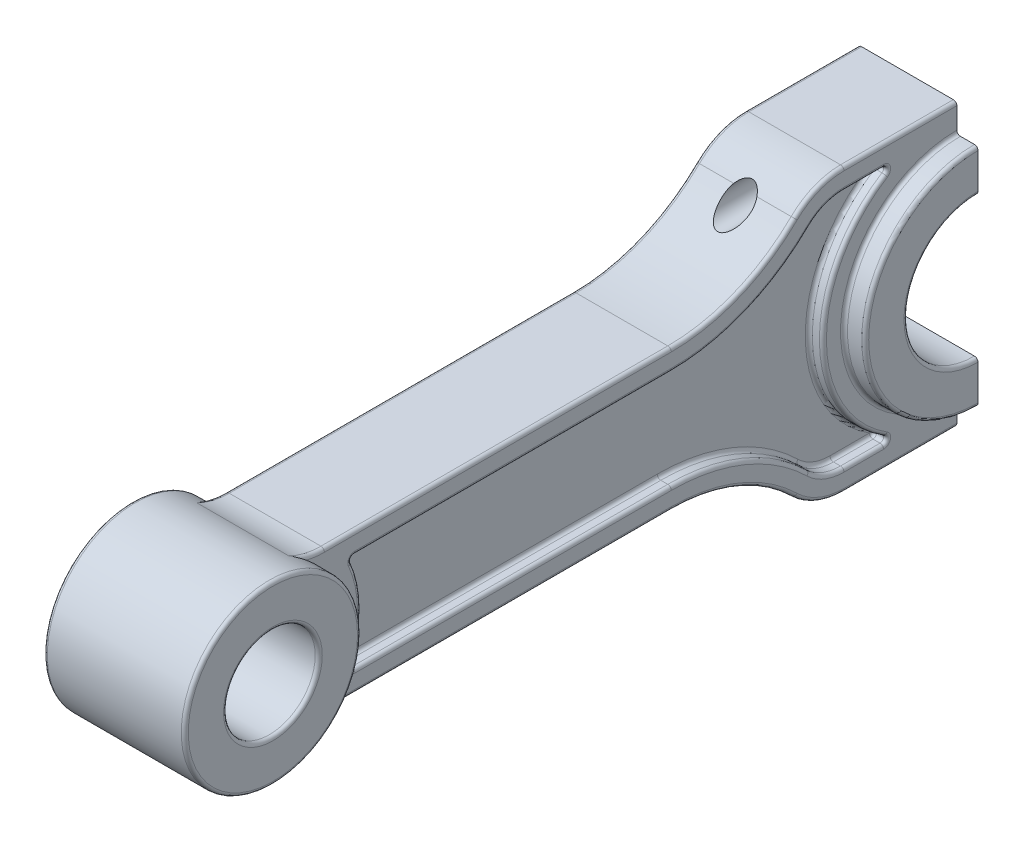
from build123d import *

# Parameters (mm, degrees)
BOSS_EXTRUDE1_DEPTH = 10
BOSS_EXTRUDE2_DEPTH = 7
SKETCH1_4_R         = 12.499999999999998
SKETCH1_4_R_2       = 6.500000000000004
BOSS_EXTRUDE3_DEPTH = 10
SKETCH1_6_R         = 12.499999999999998
SKETCH1_6_R_2       = 6.500000000000004
BOSS_EXTRUDE4_DEPTH = 5
FILLET1_R           = 0.5
FILLET2_R           = 0.5
SKETCH4_R           = 2.000000000000001
SKETCH4_R_2         = 2.0000000000000004
CUT_EXTRUDE1_DEPTH  = 36.00000000000001
FILLET3_R           = 0.5


with BuildPart() as part:
    # Sketch1 → Boss-Extrude1 (new, symmetric)
    with BuildSketch(Plane.YZ):
        with BuildLine():
            ThreePointArc((16, 0), (-1.24e-15, 16.000000000000004), (-16, -7.1e-16))
            Line((-16, 0), (-10, 0))
            ThreePointArc((-10, 1.22e-15), (-2.8e-16, 10), (10, 0))
            Line((10, 0), (16, 2.94e-15))
        make_face()
    extrude(amount=BOSS_EXTRUDE1_DEPTH, both=True)

    # Sketch1<3> → Boss-Extrude2 (add, symmetric)
    with BuildSketch(Plane.YZ):
        with BuildLine():
            ThreePointArc((-17.14285714285714, 22.998542122237655), (-19.258200997725517, 19.779644730092276), (-20, 16))
            Line((-20, 16), (-19.999999999999996, 0))
            Line((-19.999999999999996, 0), (-16, 0))
            ThreePointArc((-16, -7.1e-16), (-1.24e-15, 16.000000000000004), (16, 0))
            Line((16, 2.94e-15), (20.000000000000025, 4.9e-15))
            Line((20.000000000000025, 5.33e-15), (20.00000000000002, 16.000000000000004))
            ThreePointArc((20.00000000000002, 16.000000000000004), (19.258200997725535, 19.77964473009228), (17.14285714285716, 22.99854212223766))
            ThreePointArc((17.142857142857164, 22.998542122237662), (11.854497505686236, 31.045785602601107), (10.000000000000014, 40.49489742783179))
            Line((10.000000000000007, 40.49489742783179), (9.999999999999993, 89.69223593595584))
            ThreePointArc((9.999999999999993, 89.69223593595584), (10.281746841924491, 92.049258539911), (11.111111111111105, 94.27346440886436))
            ThreePointArc((11.111111111111107, 94.27346440886436), (0, 87.5), (-11.111111111111107, 94.27346440886436))
            ThreePointArc((-11.111111111111105, 94.27346440886436), (-10.281746841924491, 92.049258539911), (-9.999999999999993, 89.69223593595584))
            Line((-9.999999999999993, 89.69223593595584), (-9.999999999999991, 40.49489742783179))
            ThreePointArc((-9.999999999999993, 40.49489742783179), (-11.854497505686211, 31.045785602601107), (-17.14285714285714, 22.998542122237655))
        make_face()
        with BuildLine():
            Line((-16.999999999999996, 10.392304845413271), (-17, 16))
            ThreePointArc((-17, 16), (-16.480740698407857, 18.645751311064593), (-14.999999999999996, 20.89897948556636))
            ThreePointArc((-15, 20.898979485566365), (-9.077037206368551, 29.91189218357342), (-7, 40.49489742783178))
            Line((-6.999999999999999, 40.49489742783178), (-6.999999999999993, 85.37980848278654))
            ThreePointArc((-6.999999999999999, 85.37980848278654), (-6.772431183971286, 85.79907122856775), (-6.296874999999996, 85.83668946769947))
            ThreePointArc((-6.296874999999995, 85.83668946769947), (-2.66e-15, 84.5), (6.29687499999999, 85.83668946769947))
            ThreePointArc((6.296874999999996, 85.83668946769947), (6.772431183971286, 85.79907122856775), (7, 85.37980848278654))
            Line((6.999999999999993, 85.37980848278654), (7.000000000000006, 40.49489742783179))
            ThreePointArc((7.000000000000007, 40.494897427831795), (9.077037206368566, 29.911892183573425), (15.000000000000014, 20.89897948556636))
            ThreePointArc((15.000000000000018, 20.89897948556636), (16.48074069840788, 18.645751311064597), (17.00000000000002, 16.000000000000004))
            Line((17.00000000000002, 16.000000000000004), (17.000000000000018, 10.392304845413268))
            ThreePointArc((17.000000000000018, 10.392304845413268), (16.638675049056324, 9.911920383998007), (16.076923076923094, 10.12583549040267))
            ThreePointArc((16.076923076923094, 10.12583549040267), (1.155e-14, 19.000000000000018), (-16.076923076923077, 10.125835490402675))
            ThreePointArc((-16.07692307692308, 10.125835490402677), (-16.638675049056307, 9.911920383998012), (-17, 10.392304845413271))
        make_face(mode=Mode.SUBTRACT)
    extrude(amount=BOSS_EXTRUDE2_DEPTH, both=True)

    # Sketch1<4> → Boss-Extrude3 (add, symmetric)
    with BuildSketch(Plane.YZ):
        with Locations(Location((0, 100, 0), (0, 0, 270))):
            Circle(SKETCH1_4_R)
        with Locations(Location((0, 100, 0), (0, 0, 270))):
            Circle(SKETCH1_4_R_2, mode=Mode.SUBTRACT)
    extrude(amount=BOSS_EXTRUDE3_DEPTH, both=True)

    # Sketch1<6> → Boss-Extrude4 (add, symmetric)
    # profile 1 of 2: a face of its own
    with BuildSketch(Plane.YZ):
        with Locations(Location((0, 100, 0), (0, 0, 270))):
            Circle(SKETCH1_6_R)
        with Locations(Location((0, 100, 0), (0, 0, 270))):
            Circle(SKETCH1_6_R_2, mode=Mode.SUBTRACT)
    # profile 2 of 2: a face of its own
    with BuildSketch(Plane.YZ):
        with BuildLine():
            Line((-17, 16), (-16.999999999999996, 10.392304845413271))
            ThreePointArc((-16.999999999999996, 10.392304845413271), (-16.638675049056303, 9.911920383998012), (-16.076923076923077, 10.125835490402675))
            ThreePointArc((-16.076923076923077, 10.125835490402675), (5.38e-15, 19.000000000000018), (16.076923076923094, 10.12583549040267))
            ThreePointArc((16.076923076923094, 10.12583549040267), (16.638675049056324, 9.911920383998007), (17.000000000000018, 10.392304845413268))
            Line((17.000000000000018, 10.392304845413268), (17.00000000000002, 16.000000000000004))
            ThreePointArc((17.00000000000002, 16.000000000000004), (16.48074069840788, 18.645751311064597), (15.000000000000018, 20.89897948556636))
            ThreePointArc((15.000000000000018, 20.89897948556636), (9.07703720636857, 29.91189218357342), (7.000000000000006, 40.49489742783179))
            Line((7.000000000000006, 40.49489742783179), (6.999999999999993, 85.37980848278654))
            ThreePointArc((6.999999999999993, 85.37980848278654), (6.772431183971287, 85.79907122856775), (6.296874999999994, 85.83668946769947))
            ThreePointArc((6.296874999999994, 85.83668946769947), (9.5e-16, 84.5), (-6.296874999999994, 85.83668946769947))
            ThreePointArc((-6.296874999999994, 85.83668946769947), (-6.772431183971286, 85.79907122856775), (-6.999999999999993, 85.37980848278654))
            Line((-6.999999999999993, 85.37980848278654), (-6.999999999999999, 40.49489742783178))
            ThreePointArc((-6.999999999999999, 40.49489742783178), (-9.077037206368551, 29.91189218357342), (-14.999999999999996, 20.89897948556636))
            ThreePointArc((-14.999999999999996, 20.89897948556636), (-16.480740698407857, 18.645751311064593), (-17, 16))
        make_face()
    extrude(amount=BOSS_EXTRUDE4_DEPTH, both=True)

    # Fillet1
    fillet1_edges = [part.edges().sort_by_distance(p)[0] for p in [
        (10, 9.8e-16, 16.000000000000004),
        (5, -16.638675049056307, 9.911920383998012),
        (5, 1.155e-14, 19.000000000000018),
        (5, 16.638675049056324, 9.911920383998007),
        (5, 17.00000000000002, 13.196152422706636),
        (-5, 16.48074069840788, 18.645751311064597),
        (-5, 9.077037206368566, 29.911892183573425),
        (-5, 7, 62.937352955309166),
        (-5, 6.772431183971286, 85.79907122856775),
        (5, 2.66e-15, 84.5),
        (5, -6.772431183971286, 85.79907122856775),
        (5, -6.9999999999999964, 62.937352955309166),
        (5, -9.077037206368551, 29.91189218357342),
        (5, -16.480740698407857, 18.645751311064593),
        (-5, -17, 13.196152422706636),
        (5, 16.48074069840788, 18.645751311064597),
        (5, 9.077037206368566, 29.911892183573425),
        (5, 7, 62.937352955309166),
        (5, 6.772431183971286, 85.79907122856775),
        (5, -17, 13.196152422706636),
        (-5, -16.638675049056307, 9.911920383998012),
        (-5, -16.480740698407857, 18.645751311064593),
        (-5, -9.077037206368551, 29.91189218357342),
        (-5, -6.9999999999999964, 62.937352955309166),
        (-5, -6.772431183971286, 85.79907122856775),
        (-5, 2.66e-15, 84.5),
        (-5, 17.00000000000002, 13.196152422706636),
        (-5, 16.638675049056324, 9.911920383998007),
        (-5, 1.155e-14, 19.000000000000018),
        (-7, 9.77e-15, 19.000000000000014),
        (-7, -16.638675049056307, 9.911920383998012),
        (7, -17, 13.196152422706636),
        (-7, -16.480740698407857, 18.645751311064593),
        (-7, -9.077037206368551, 29.91189218357342),
        (-7, -6.9999999999999964, 62.937352955309166),
        (-7, -6.772431183971288, 85.79907122856775),
        (-7, -4e-15, 84.5),
        (7, 6.772431183971288, 85.79907122856775),
        (7, 7, 62.937352955309166),
        (7, 9.07703720636857, 29.91189218357343),
        (7, 16.48074069840788, 18.645751311064597),
        (-7, 17.00000000000002, 13.196152422706636),
        (7, -2.57e-15, 16.000000000000004),
        (-7, 16.638675049056324, 9.911920383998007),
        (7, 9.77e-15, 19.000000000000014),
        (7, -16.638675049056307, 9.911920383998012),
        (7, -16.480740698407857, 18.645751311064593),
        (7, -9.077037206368551, 29.91189218357342),
        (7, -6.9999999999999964, 62.937352955309166),
        (7, -6.772431183971288, 85.79907122856775),
        (7, -4e-15, 84.5),
        (7, 17.00000000000002, 13.196152422706636),
        (7, 16.638675049056324, 9.911920383998007),
        (-7, -2.57e-15, 16.000000000000004),
        (-7, 16.48074069840788, 18.645751311064597),
        (-7, 9.07703720636857, 29.91189218357343),
        (-7, 7, 62.937352955309166),
        (-7, 6.772431183971288, 85.79907122856775),
        (-7, -17, 13.196152422706636),
        (-10, 9.8e-16, 16.000000000000004),
    ]]
    fillet(fillet1_edges, radius=FILLET1_R)

    # Fillet2
    # the kernel refuses this fillet: 0.5 mm, written as the material it takes off along each edge
    with BuildSketch(Plane(origin=(-7, 10.000000000000039, 16.000000000000014), x_dir=(0, 1, -1.07e-15), z_dir=(0, -1.07e-15, -1))) as fillet2_piece_1:
        with BuildLine():
            CenterArc((9.999999999999982 - FILLET2_R, FILLET2_R), FILLET2_R, 270, 90)
            Line((9.999999999999982, FILLET2_R), (9.999999999999982, 0))
            Line((9.999999999999982, 0), (9.999999999999982 - FILLET2_R, 0))
        make_face()
    revolve(axis=Axis((-7, 10.000000000000039, 16.000000000000014), (1, 0, 0)), revolution_arc=44.4153085971931, mode=Mode.SUBTRACT)
    with BuildSketch(Plane(origin=(-7, 35.000000000000085, 40.49489742783182), x_dir=(0, -0.714285714285715, -0.6998542122237645), z_dir=(0, 0.6998542122237645, -0.714285714285715))) as fillet2_piece_2:
        with BuildLine():
            CenterArc((25.000000000000075 + FILLET2_R, -FILLET2_R), FILLET2_R, 90, 90)
            Line((25.000000000000075, -FILLET2_R), (25.000000000000075, 0))
            Line((25.000000000000075, 0), (25.000000000000075 + FILLET2_R, 0))
        make_face()
    revolve(axis=Axis((-7, 35.000000000000085, 40.49489742783182), (-1, 0, 0)), revolution_arc=44.41530859719284, mode=Mode.SUBTRACT)
    with BuildSketch(Plane(origin=(-7, 10.000000000000007, 40.49489742783179), x_dir=(0, -1, -2.9e-16), z_dir=(0, -2.9e-16, 1)), Plane(origin=(-7, -9.999999999999993, 89.69223593595584), x_dir=(0, 1, 4e-17), z_dir=(0, 4e-17, -1))) as fillet2_piece_3:
        with BuildLine():
            CenterArc((FILLET2_R, FILLET2_R), FILLET2_R, 180, 90)
            Line((0, FILLET2_R), (0, 0))
            Line((0, 0), (FILLET2_R, 0))
        make_face()
    extrude(amount=49.19733850812405, mode=Mode.SUBTRACT)
    with BuildSketch(Plane(origin=(7, 20.000000000000007, 89.69223593595584), x_dir=(0, -1, 0), z_dir=(0, 0, -1))) as fillet2_piece_4_section:
        with BuildLine():
            CenterArc((10.000000000000014 + FILLET2_R, FILLET2_R), FILLET2_R, 180, 90)
            Line((10.000000000000014, FILLET2_R), (10.000000000000014, 0))
            Line((10.000000000000014, 0), (10.000000000000014 + FILLET2_R, 0))
        make_face()
    fillet2_piece_4 = revolve(axis=Axis((7, 20.000000000000007, 89.69223593595584), (-1, 0, 0)), revolution_arc=34.42828088240895, mode=Mode.PRIVATE)
    fillet2_piece_4 = fillet2_piece_4 - Plane(origin=(6.916500535686011, 0, 100), x_dir=(0, -1.8e-16, -1), z_dir=(1, 0, 0)) * Cylinder(12.499999999999998, 43, mode=Mode.PRIVATE)
    add(fillet2_piece_4, mode=Mode.SUBTRACT)
    with BuildSketch(Plane(origin=(-7, -19.999999999999968, 89.69223593595585), x_dir=(0, 0.8248345331629863, 0.5653742060810686), z_dir=(0, -0.5653742060810686, 0.8248345331629863))) as fillet2_piece_5_section:
        with BuildLine():
            CenterArc((9.999999999999979 + FILLET2_R, -FILLET2_R), FILLET2_R, 90, 90)
            Line((9.999999999999973, -FILLET2_R), (9.999999999999979, 0))
            Line((9.999999999999979, 0), (9.999999999999979 + FILLET2_R, 0))
        make_face()
    fillet2_piece_5 = revolve(axis=Axis((-7, -19.999999999999968, 89.69223593595585), (-1, 0, 0)), revolution_arc=34.4282808824091, mode=Mode.PRIVATE)
    fillet2_piece_5 = fillet2_piece_5 - Plane(origin=(-6.861994931360741, 0, 100), x_dir=(0, -1.8e-16, -1), z_dir=(1, 0, 0)) * Cylinder(12.499999999999998, 42, mode=Mode.PRIVATE)
    add(fillet2_piece_5, mode=Mode.SUBTRACT)
    with BuildSketch(Plane(origin=(7, -9.999999999999993, 89.69223593595584), x_dir=(0, 1, 4e-17), z_dir=(0, 4e-17, -1)), Plane(origin=(7, 10.000000000000007, 40.49489742783179), x_dir=(0, -1, -2.9e-16), z_dir=(0, -2.9e-16, 1))) as fillet2_piece_6:
        with BuildLine():
            CenterArc((FILLET2_R, -FILLET2_R), FILLET2_R, 90, 90)
            Line((0, -FILLET2_R), (0, 0))
            Line((0, 0), (FILLET2_R, 0))
        make_face()
    extrude(amount=49.19733850812405, mode=Mode.SUBTRACT)
    with BuildSketch(Plane(origin=(7, -35.000000000000014, 40.494897427831795), x_dir=(0, 1, -2.8e-16), z_dir=(0, 2.8e-16, 1))) as fillet2_piece_7:
        with BuildLine():
            CenterArc((25.000000000000018 + FILLET2_R, FILLET2_R), FILLET2_R, 180, 90)
            Line((25.000000000000018, FILLET2_R), (25.000000000000018, 0))
            Line((25.000000000000018, 0), (25.000000000000018 + FILLET2_R, 0))
        make_face()
    revolve(axis=Axis((7, -35.000000000000014, 40.494897427831795), (-1, 0, 0)), revolution_arc=44.41530859719295, mode=Mode.SUBTRACT)
    with BuildSketch(Plane(origin=(7, -10.000000000000043, 16.000000000000014), x_dir=(0, -0.7142857142857125, 0.699854212223767), z_dir=(0, 0.699854212223767, 0.7142857142857125))) as fillet2_piece_8:
        with BuildLine():
            CenterArc((9.99999999999996 - FILLET2_R, -FILLET2_R), FILLET2_R, 0, 90)
            Line((9.99999999999996, -FILLET2_R), (9.99999999999996, 0))
            Line((9.99999999999996, 0), (9.99999999999996 - FILLET2_R, 0))
        make_face()
    revolve(axis=Axis((7, -10.000000000000043, 16.000000000000014), (1, 0, 0)), revolution_arc=44.4153085971932, mode=Mode.SUBTRACT)
    with BuildSketch(Plane(origin=(-7, -20, 16), x_dir=(0, 1, 2.2e-16), z_dir=(0, 2.2e-16, -1)), Plane(origin=(-7, 20.000000000000025, -1.249999999999993), x_dir=(0, -1, -2.2e-16), z_dir=(0, -2.2e-16, 1))) as fillet2_piece_9:
        with BuildLine():
            CenterArc((FILLET2_R, FILLET2_R), FILLET2_R, 180, 90)
            Line((0, FILLET2_R), (0, 0))
            Line((0, 0), (FILLET2_R, 0))
        make_face()
    extrude(amount=17.25, mode=Mode.SUBTRACT)
    with BuildSketch(Plane(origin=(7, 20.000000000000025, -1.2499999999999947), x_dir=(-1, 0, 0), z_dir=(0, -2.2e-16, 1))) as fillet2_piece_10:
        with BuildLine():
            CenterArc((FILLET2_R, FILLET2_R), FILLET2_R, 180, 90)
            Line((0, FILLET2_R), (0, 0))
            Line((0, 0), (FILLET2_R, 0))
        make_face()
    extrude(amount=17.25, mode=Mode.SUBTRACT)
    with BuildSketch(Plane(origin=(7, 10.000000000000039, 16.000000000000014), x_dir=(0, 1, -1.07e-15), z_dir=(0, -1.07e-15, -1))) as fillet2_piece_11:
        with BuildLine():
            CenterArc((9.999999999999982 - FILLET2_R, -FILLET2_R), FILLET2_R, 0, 90)
            Line((9.999999999999982, -FILLET2_R), (9.999999999999982, 0))
            Line((9.999999999999982, 0), (9.999999999999982 - FILLET2_R, 0))
        make_face()
    revolve(axis=Axis((7, 10.000000000000039, 16.000000000000014), (1, 0, 0)), revolution_arc=44.4153085971931, mode=Mode.SUBTRACT)
    with BuildSketch(Plane(origin=(7, 35.000000000000085, 40.49489742783182), x_dir=(0, -0.714285714285715, -0.6998542122237645), z_dir=(0, 0.6998542122237645, -0.714285714285715))) as fillet2_piece_12:
        with BuildLine():
            CenterArc((25.000000000000075 + FILLET2_R, FILLET2_R), FILLET2_R, 180, 90)
            Line((25.000000000000075, FILLET2_R), (25.000000000000075, 0))
            Line((25.000000000000075, 0), (25.000000000000075 + FILLET2_R, 0))
        make_face()
    revolve(axis=Axis((7, 35.000000000000085, 40.49489742783182), (-1, 0, 0)), revolution_arc=44.41530859719284, mode=Mode.SUBTRACT)
    with BuildSketch(Plane(origin=(7, -19.999999999999968, 89.69223593595585), x_dir=(0, 0.8248345331629863, 0.5653742060810686), z_dir=(0, -0.5653742060810686, 0.8248345331629863))) as fillet2_piece_13_section:
        with BuildLine():
            CenterArc((9.999999999999979 + FILLET2_R, FILLET2_R), FILLET2_R, 180, 90)
            Line((9.999999999999973, FILLET2_R), (9.999999999999979, 0))
            Line((9.999999999999979, 0), (9.999999999999979 + FILLET2_R, 0))
        make_face()
    fillet2_piece_13 = revolve(axis=Axis((7, -19.999999999999968, 89.69223593595585), (-1, 0, 0)), revolution_arc=34.4282808824091, mode=Mode.PRIVATE)
    fillet2_piece_13 = fillet2_piece_13 - Plane(origin=(6.861994931360841, 0, 100), x_dir=(0, -1.8e-16, -1), z_dir=(1, 0, 0)) * Cylinder(12.499999999999998, 42, mode=Mode.PRIVATE)
    add(fillet2_piece_13, mode=Mode.SUBTRACT)
    with BuildSketch(Plane(origin=(7, -20, 16), x_dir=(0, 1, 2.2e-16), z_dir=(0, 2.2e-16, -1))) as fillet2_piece_14:
        with BuildLine():
            CenterArc((FILLET2_R, -FILLET2_R), FILLET2_R, 90, 90)
            Line((0, -FILLET2_R), (0, 0))
            Line((0, 0), (FILLET2_R, 0))
        make_face()
    extrude(amount=17.25, mode=Mode.SUBTRACT)
    with BuildSketch(Plane(origin=(-7, -10.000000000000043, 16.000000000000014), x_dir=(0, -0.7142857142857125, 0.699854212223767), z_dir=(0, 0.699854212223767, 0.7142857142857125))) as fillet2_piece_15:
        with BuildLine():
            CenterArc((9.99999999999996 - FILLET2_R, FILLET2_R), FILLET2_R, 270, 90)
            Line((9.99999999999996, FILLET2_R), (9.99999999999996, 0))
            Line((9.99999999999996, 0), (9.99999999999996 - FILLET2_R, 0))
        make_face()
    revolve(axis=Axis((-7, -10.000000000000043, 16.000000000000014), (1, 0, 0)), revolution_arc=44.4153085971932, mode=Mode.SUBTRACT)
    with BuildSketch(Plane(origin=(-7, -35.000000000000014, 40.494897427831795), x_dir=(0, 1, -2.8e-16), z_dir=(0, 2.8e-16, 1))) as fillet2_piece_16:
        with BuildLine():
            CenterArc((25.000000000000018 + FILLET2_R, -FILLET2_R), FILLET2_R, 90, 90)
            Line((25.000000000000018, -FILLET2_R), (25.000000000000018, 0))
            Line((25.000000000000018, 0), (25.000000000000018 + FILLET2_R, 0))
        make_face()
    revolve(axis=Axis((-7, -35.000000000000014, 40.494897427831795), (-1, 0, 0)), revolution_arc=44.41530859719295, mode=Mode.SUBTRACT)
    with BuildSketch(Plane(origin=(-7, 20.000000000000007, 89.69223593595584), x_dir=(0, -1, 0), z_dir=(0, 0, -1))) as fillet2_piece_17_section:
        with BuildLine():
            CenterArc((10.000000000000014 + FILLET2_R, -FILLET2_R), FILLET2_R, 90, 90)
            Line((10.000000000000014, -FILLET2_R), (10.000000000000014, 0))
            Line((10.000000000000014, 0), (10.000000000000014 + FILLET2_R, 0))
        make_face()
    fillet2_piece_17 = revolve(axis=Axis((-7, 20.000000000000007, 89.69223593595584), (-1, 0, 0)), revolution_arc=34.42828088240895, mode=Mode.PRIVATE)
    fillet2_piece_17 = fillet2_piece_17 - Plane(origin=(-6.916500535686035, 0, 100), x_dir=(0, -1.8e-16, -1), z_dir=(1, 0, 0)) * Cylinder(12.499999999999998, 43, mode=Mode.PRIVATE)
    add(fillet2_piece_17, mode=Mode.SUBTRACT)
    with BuildSketch(Plane(origin=(10, 0, 100), x_dir=(0, -1.8e-16, -1), z_dir=(0, -1, 1.8e-16))) as fillet2_piece_18:
        with BuildLine():
            CenterArc((6.5 + FILLET2_R, -FILLET2_R), FILLET2_R, 90, 90)
            Line((6.5, -FILLET2_R), (6.5, 0))
            Line((6.5, 0), (6.5 + FILLET2_R, 0))
        make_face()
    revolve(axis=Axis((10, 0, 100), (1, 0, 0)), mode=Mode.SUBTRACT)
    with BuildSketch(Plane(origin=(-10, 0, 100), x_dir=(0, -1.8e-16, -1), z_dir=(0, -1, 1.8e-16))) as fillet2_piece_19:
        with BuildLine():
            CenterArc((12.5 - FILLET2_R, FILLET2_R), FILLET2_R, 270, 90)
            Line((12.5 - FILLET2_R, 0), (12.5, 0))
            Line((12.5, 0), (12.5, FILLET2_R))
        make_face()
    revolve(axis=Axis((-10, 0, 100), (1, 0, 0)), mode=Mode.SUBTRACT)
    with BuildSketch(Plane(origin=(10, 0, 100), x_dir=(0, -1.8e-16, -1), z_dir=(0, -1, 1.8e-16))) as fillet2_piece_20:
        with BuildLine():
            CenterArc((12.5 - FILLET2_R, -FILLET2_R), FILLET2_R, 0, 90)
            Line((12.5 - FILLET2_R, 0), (12.5, 0))
            Line((12.5, 0), (12.5, -FILLET2_R))
        make_face()
    revolve(axis=Axis((10, 0, 100), (1, 0, 0)), mode=Mode.SUBTRACT)
    with BuildSketch(Plane(origin=(-10, 0, 100), x_dir=(0, -1.8e-16, -1), z_dir=(0, -1, 1.8e-16))) as fillet2_piece_21:
        with BuildLine():
            CenterArc((6.5 + FILLET2_R, FILLET2_R), FILLET2_R, 180, 90)
            Line((6.5, FILLET2_R), (6.5, 0))
            Line((6.5, 0), (6.5 + FILLET2_R, 0))
        make_face()
    revolve(axis=Axis((-10, 0, 100), (1, 0, 0)), mode=Mode.SUBTRACT)

    # Sketch4 → Cut-Extrude1 (cut)
    with BuildSketch(Plane(origin=(0, 0, 0), x_dir=(1, 0, 0), z_dir=(0, 0, -1))):
        with Locations(Location((0, 16, 0), (0, 0, 180))):
            Circle(SKETCH4_R)
        with Locations(Location((0, -16, 0), (0, 0, 214.849904579))):
            Circle(SKETCH4_R_2)
    extrude(amount=-CUT_EXTRUDE1_DEPTH, mode=Mode.SUBTRACT)

    # Fillet3
    fillet3_edges = [part.edges().sort_by_distance(p)[0] for p in [
        (10, 6.1e-16, 10),
        (-10, 6.1e-16, 10),
    ]]
    fillet(fillet3_edges, radius=FILLET3_R)


solid = part.part
